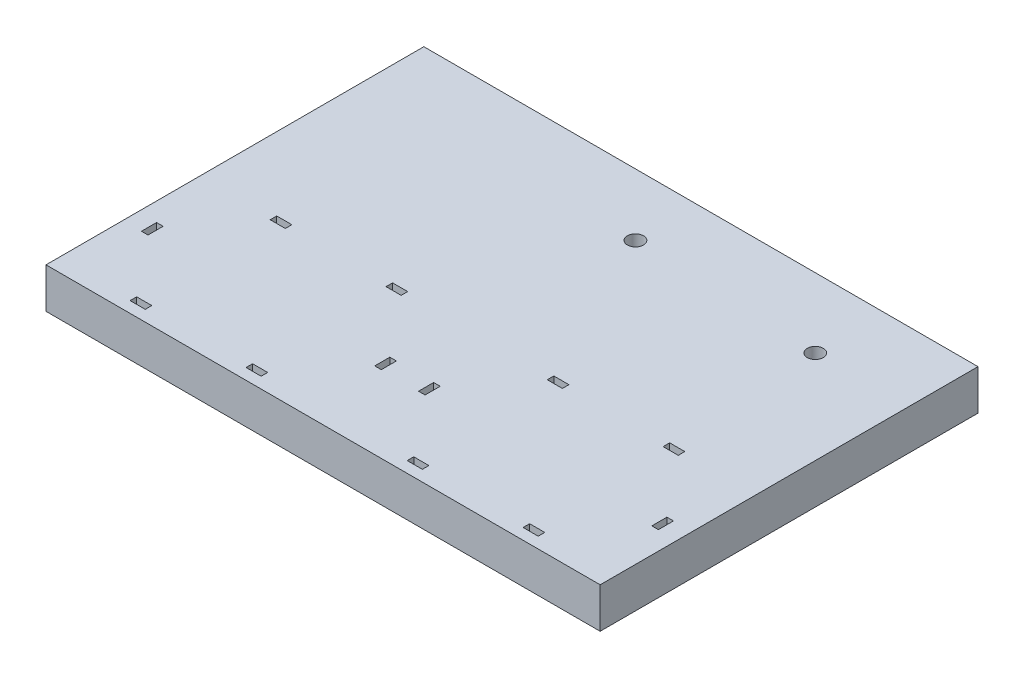
from build123d import *

# Parameters (mm, degrees)
SKETCH1_W           = 110
SKETCH1_H           = 75
SKETCH1_R           = 1.6
SKETCH1_W_2         = 3
SKETCH1_H_2         = 1.3
SKETCH1_W_3         = 1.3
SKETCH1_H_3         = 3
BOSS_EXTRUDE1_DEPTH = 8


with BuildPart() as part:
    # Sketch1 → Boss-Extrude1 (new body)
    with BuildSketch(Plane(origin=(0, 0, 0), x_dir=(1, 0, 0), z_dir=(0, 1, 0))):
        Rectangle(SKETCH1_W, SKETCH1_H)
        with Locations((36.5, 23.7)):
            Circle(SKETCH1_R, mode=Mode.SUBTRACT)
        with Locations((-0.7, 25.2)):
            Circle(SKETCH1_R, mode=Mode.SUBTRACT)
        with Locations((39, -6.85)):
            Rectangle(SKETCH1_W_2, SKETCH1_H_2, mode=Mode.SUBTRACT)
        with Locations((16, -6.85)):
            Rectangle(SKETCH1_W_2, SKETCH1_H_2, mode=Mode.SUBTRACT)
        with Locations((4.35, -20.75)):
            Rectangle(SKETCH1_W_3, SKETCH1_H_3, mode=Mode.SUBTRACT)
        with Locations((50.65, -20.75)):
            Rectangle(SKETCH1_W_3, SKETCH1_H_3, mode=Mode.SUBTRACT)
        with Locations((39, -34.65)):
            Rectangle(SKETCH1_W_2, SKETCH1_H_2, mode=Mode.SUBTRACT)
        with Locations((16, -34.65)):
            Rectangle(SKETCH1_W_2, SKETCH1_H_2, mode=Mode.SUBTRACT)
        with Locations((-16, -34.65)):
            Rectangle(SKETCH1_W_2, SKETCH1_H_2, mode=Mode.SUBTRACT)
        with Locations((-39, -34.65)):
            Rectangle(SKETCH1_W_2, SKETCH1_H_2, mode=Mode.SUBTRACT)
        with Locations((-50.65, -20.75)):
            Rectangle(SKETCH1_W_3, SKETCH1_H_3, mode=Mode.SUBTRACT)
        with Locations((-39, -6.85)):
            Rectangle(SKETCH1_W_2, SKETCH1_H_2, mode=Mode.SUBTRACT)
        with Locations((-4.35, -20.75)):
            Rectangle(SKETCH1_W_3, SKETCH1_H_3, mode=Mode.SUBTRACT)
        with Locations((-16, -6.85)):
            Rectangle(SKETCH1_W_2, SKETCH1_H_2, mode=Mode.SUBTRACT)
    extrude(amount=BOSS_EXTRUDE1_DEPTH)


solid = part.part
